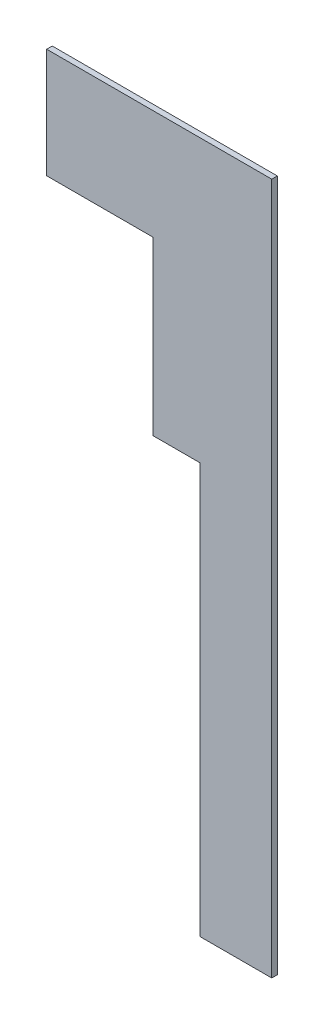
from build123d import *

# Parameters (mm, degrees)
TABAN_FLAN_1_DEPTH         = 30
KES_EKSTR_ZYON1_DEPTH      = 6352.822258219
KES_EKSTR_ZYON1_DEPTH_BACK = 6352.822258219
IZIM2_W                    = 259
IZIM2_H                    = 3030
KES_EKSTR_ZYON2_DEPTH      = 6352.822258219
KES_EKSTR_ZYON2_DEPTH_BACK = 6352.822258219
KES_EKSTR_ZYON3_DEPTH      = 6352.822258219
KES_EKSTR_ZYON3_DEPTH_BACK = 6352.822258219
IZIM4_W                    = 1491
IZIM4_H                    = 1015
KES_EKSTR_ZYON4_DEPTH      = 5399.622139028
KES_EKSTR_ZYON4_DEPTH_BACK = 5399.622139028
IZIM5_W                    = 170
IZIM5_H                    = 2081
KES_EKSTR_ZYON5_DEPTH      = 5399.622139028
KES_EKSTR_ZYON5_DEPTH_BACK = 5399.622139028
KES_EKSTR_ZYON7_DEPTH      = 5399.622139028
KES_EKSTR_ZYON7_DEPTH_BACK = 5399.622139028
IZIM7_W                    = 280
IZIM7_H                    = 2181
KES_EKSTR_ZYON8_DEPTH      = 5399.622139028
KES_EKSTR_ZYON8_DEPTH_BACK = 5399.622139028
IZIM8_W                    = 140
IZIM8_H                    = 365
KES_EKSTR_ZYON9_DEPTH      = 5399.622139028
KES_EKSTR_ZYON9_DEPTH_BACK = 5399.622139028
IZIM9_W                    = 572
IZIM9_H                    = 626
IZIM9_W_2                  = 385
IZIM9_H_2                  = 3


# Sheet-metal steps are written as plain solids
with BuildPart() as part:
    # Çizim1 → Taban-Flanş1 (new body)
    with BuildSketch(Plane.XY):
        Polygon((0, 0), (0, 3000), (261, 3000), (261, 6025), (2011, 6025), (2011, 0), align=None)
    extrude(amount=-TABAN_FLAN_1_DEPTH)

    # Çizim2 → Kes-Ekstrüzyon1 (cut, two sides: drawn at the far end of the back side and taken through both)
    with BuildSketch(Plane.XY.offset(-KES_EKSTR_ZYON1_DEPTH_BACK)):
        with Locations((390.5, 4510)):
            Rectangle(IZIM2_W, IZIM2_H)
    extrude(amount=KES_EKSTR_ZYON1_DEPTH + KES_EKSTR_ZYON1_DEPTH_BACK, mode=Mode.SUBTRACT)

    # Çizim3 → Kes-Ekstrüzyon2 (cut, two sides: drawn at the far end of the back side and taken through both)
    with BuildSketch(Plane.XY.offset(-KES_EKSTR_ZYON2_DEPTH_BACK)):
        Polygon((0, 919), (1200, 919), (1200, 1284), (2011, 1284), (2011, 0), (0, 0), align=None)
    extrude(amount=KES_EKSTR_ZYON2_DEPTH + KES_EKSTR_ZYON2_DEPTH_BACK, mode=Mode.SUBTRACT)

    # Çizim4 → Kes-Ekstrüzyon3 (cut, two sides: drawn at the far end of the back side and taken through both)
    with BuildSketch(Plane.XY.offset(-KES_EKSTR_ZYON3_DEPTH_BACK)):
        with Locations((1265.5, 5517.5)):
            Rectangle(IZIM4_W, IZIM4_H)
    extrude(amount=KES_EKSTR_ZYON3_DEPTH + KES_EKSTR_ZYON3_DEPTH_BACK, mode=Mode.SUBTRACT)

    # Çizim5 → Kes-Ekstrüzyon4 (cut, two sides: drawn at the far end of the back side and taken through both)
    with BuildSketch(Plane.XY.offset(-KES_EKSTR_ZYON4_DEPTH_BACK)):
        with Locations((85, 1959.5)):
            Rectangle(IZIM5_W, IZIM5_H)
    extrude(amount=KES_EKSTR_ZYON4_DEPTH + KES_EKSTR_ZYON4_DEPTH_BACK, mode=Mode.SUBTRACT)

    # Çizim6 → Kes-Ekstrüzyon5 (cut, two sides: drawn at the far end of the back side and taken through both)
    with BuildSketch(Plane.XY.offset(-KES_EKSTR_ZYON5_DEPTH_BACK)):
        Polygon((520, 2995), (520, 2829), (800, 2829), (800, 1465.844716129), (800, 919), (0, 663.665767546), (0, 3349.606588957), align=None)
    extrude(amount=KES_EKSTR_ZYON5_DEPTH + KES_EKSTR_ZYON5_DEPTH_BACK, mode=Mode.SUBTRACT)

    # Çizim7 → Kes-Ekstrüzyon7 (cut, two sides: drawn at the far end of the back side and taken through both)
    with BuildSketch(Plane.XY.offset(-KES_EKSTR_ZYON7_DEPTH_BACK)):
        with Locations((660, 3919.5)):
            Rectangle(IZIM7_W, IZIM7_H)
    extrude(amount=KES_EKSTR_ZYON7_DEPTH + KES_EKSTR_ZYON7_DEPTH_BACK, mode=Mode.SUBTRACT)

    # Çizim8 → Kes-Ekstrüzyon8 (cut, two sides: drawn at the far end of the back side and taken through both)
    with BuildSketch(Plane.XY.offset(-KES_EKSTR_ZYON8_DEPTH_BACK)):
        Polygon((1060, 3794), (800, 3794), (800, 919), (1060, 919), (1060, 1284), align=None)
        Polygon((1372, 3794), (1060, 3794), (1060, 1284), (1200, 1284), (1372, 1284), align=None)
        with Locations((1130, 1101.5)):
            Rectangle(IZIM8_W, IZIM8_H)
    extrude(amount=KES_EKSTR_ZYON8_DEPTH + KES_EKSTR_ZYON8_DEPTH_BACK, mode=Mode.SUBTRACT)

    # Çizim9 → Kes-Ekstrüzyon9 (cut, two sides: drawn at the far end of the back side and taken through both)
    with BuildSketch(Plane.XY.offset(-KES_EKSTR_ZYON9_DEPTH_BACK)):
        with Locations((1086, 4107)):
            Rectangle(IZIM9_W, IZIM9_H)
        Polygon((1626, 3495), (1372, 3495), (1372, 1284), (1626, 1284), (1626, 1287), align=None)
        with Locations((1818.5, 1285.5)):
            Rectangle(IZIM9_W_2, IZIM9_H_2)
    extrude(amount=KES_EKSTR_ZYON9_DEPTH + KES_EKSTR_ZYON9_DEPTH_BACK, mode=Mode.SUBTRACT)


solid = part.part
